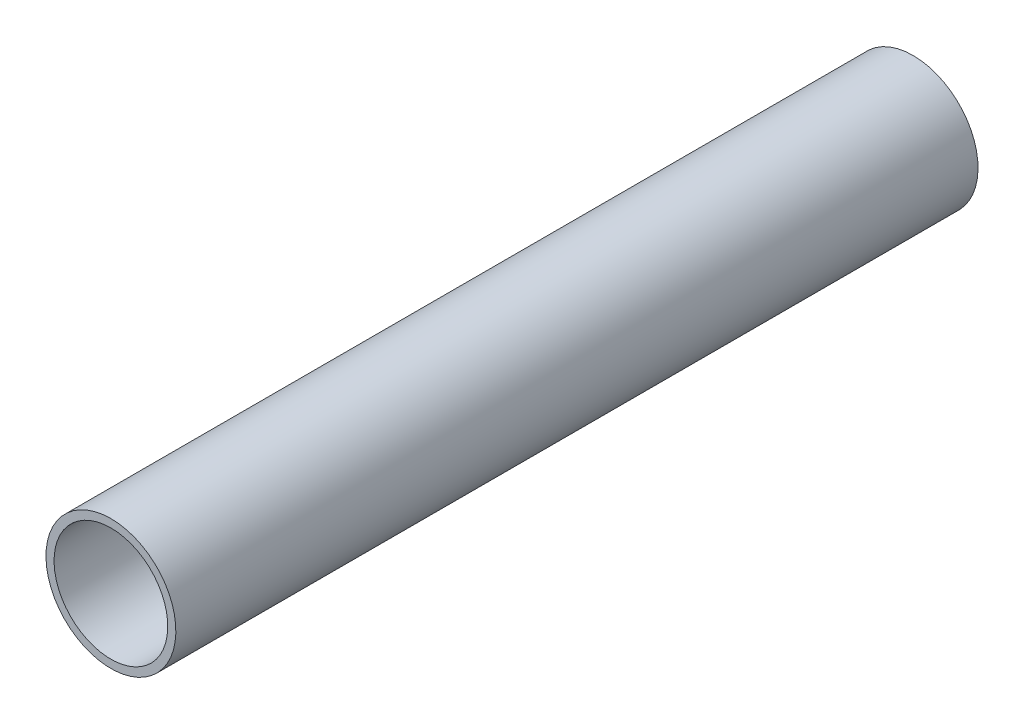
from build123d import *

# Parameters (mm, degrees)
SKETCH2_W = 1999.999999992
SKETCH2_H = 20.193


with BuildPart() as part:
    # Sketch2 → Revolve1 (revolve)
    with BuildSketch(Plane(origin=(0, 0, 0), x_dir=(0, 0, -1), z_dir=(1, 0, 0))):
        with Locations((0, 151.8285)):
            Rectangle(SKETCH2_W, SKETCH2_H)
    revolve(axis=Axis((0, 0, -17.970111657), (0, 0, 1)))


solid = part.part
